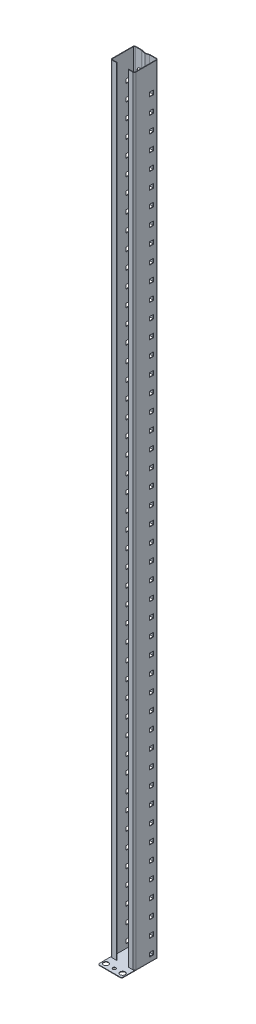
from build123d import *

# Parameters (mm, degrees)
BOSS_EXTRUDE1_DEPTH = 2438.4
SKETCH2_W           = 12.7
SKETCH2_H           = 12.7
CUT_EXTRUDE1_DEPTH  = 2440.826498226
CUT_EXTRUDE2_DEPTH  = 25.4
LPATTERN1_COUNT     = 47
LPATTERN1_PITCH     = 50.8
SKETCH4_R           = 4.7625
SKETCH4_R_2         = 7.9375
BOSS_EXTRUDE2_DEPTH = 1.5875


with BuildPart() as part:
    # Sketch1 → Boss-Extrude1 (new body)
    with BuildSketch(Plane(origin=(0, 0, 0), x_dir=(1, 0, 0), z_dir=(0, 1, 0))):
        with BuildLine():
            Line((-11.303227124, 37.1454439), (-1.227118373, 34.458481566))
            ThreePointArc((-1.227118373, 34.458481566), (0, 34.297675466), (1.227118373, 34.458481566))
            Line((1.227118373, 34.458481566), (11.303227124, 37.1454439))
            ThreePointArc((11.303227124, 37.1454439), (11.91154058, 37.265877352), (12.530345498, 37.30625))
            Line((12.530345498, 37.30625), (32.54375, 37.30625))
            ThreePointArc((32.54375, 37.30625), (35.911346045, 35.911346045), (37.30625, 32.54375))
            Line((37.30625, 32.54375), (37.30625, -32.54375))
            ThreePointArc((37.30625, -32.54375), (35.911346045, -35.911346045), (32.54375, -37.30625))
            Line((32.54375, -37.30625), (18.25625, -37.30625))
            Line((18.25625, -37.30625), (18.25625, -35.71875))
            Line((18.25625, -35.71875), (32.54375, -35.71875))
            ThreePointArc((32.54375, -35.71875), (34.78881403, -34.78881403), (35.71875, -32.54375))
            Line((35.71875, -32.54375), (35.71875, 32.54375))
            ThreePointArc((35.71875, 32.54375), (34.78881403, 34.78881403), (32.54375, 35.71875))
            Line((32.54375, 35.71875), (12.530345498, 35.71875))
            ThreePointArc((12.530345498, 35.71875), (12.117808886, 35.691834901), (11.712266582, 35.611545933))
            Line((11.712266582, 35.611545933), (1.636157831, 32.9245836))
            ThreePointArc((1.636157831, 32.9245836), (0, 32.710175466), (-1.636157831, 32.9245836))
            Line((-1.636157831, 32.9245836), (-11.712266582, 35.611545933))
            ThreePointArc((-11.712266582, 35.611545933), (-12.117808886, 35.691834901), (-12.530345498, 35.71875))
            Line((-12.530345498, 35.71875), (-32.54375, 35.71875))
            ThreePointArc((-32.54375, 35.71875), (-34.78881403, 34.78881403), (-35.71875, 32.54375))
            Line((-35.71875, 32.54375), (-35.71875, -32.54375))
            ThreePointArc((-35.71875, -32.54375), (-34.78881403, -34.78881403), (-32.54375, -35.71875))
            Line((-32.54375, -35.71875), (-18.25625, -35.71875))
            Line((-18.25625, -35.71875), (-18.25625, -37.30625))
            Line((-18.25625, -37.30625), (-32.54375, -37.30625))
            ThreePointArc((-32.54375, -37.30625), (-35.911346045, -35.911346045), (-37.30625, -32.54375))
            Line((-37.30625, -32.54375), (-37.30625, 32.54375))
            ThreePointArc((-37.30625, 32.54375), (-35.911346045, 35.911346045), (-32.54375, 37.30625))
            Line((-32.54375, 37.30625), (-12.530345498, 37.30625))
            ThreePointArc((-12.530345498, 37.30625), (-11.91154058, 37.265877352), (-11.303227124, 37.1454439))
        make_face()
    extrude(amount=BOSS_EXTRUDE1_DEPTH)

    # Sketch2 → Cut-Extrude1 (cut, through all)
    with BuildSketch(Plane(origin=(37.30625, 0, 0), x_dir=(0, 0, -1), z_dir=(1, 0, 0))):
        with Locations((16.66875, 19.05)):
            Rectangle(SKETCH2_W, SKETCH2_H)
    cut_extrude1 = extrude(amount=-CUT_EXTRUDE1_DEPTH, mode=Mode.SUBTRACT)

    # Sketch3 → Cut-Extrude2 (cut)
    with BuildSketch(Plane(origin=(0, 0, -37.30625), x_dir=(-1, 0, 0), z_dir=(0, 0, -1))):
        with BuildLine():
            Line((21.765456388, 28.121428571), (26.068412775, 37.192857143))
            ThreePointArc((26.068412775, 37.192857143), (14.628173804, 50.36852627), (12.7, 33.026108029))
            Line((12.7, 33.026108029), (12.7, 30.1625))
            ThreePointArc((12.7, 30.1625), (16.416417677, 25.516306071), (21.765456388, 28.121428571))
        make_face()
        with BuildLine():
            Line((-12.7, 30.1625), (-12.7, 33.026108029))
            ThreePointArc((-12.7, 33.026108029), (-14.628173804, 50.36852627), (-26.068412775, 37.192857143))
            Line((-26.068412775, 37.192857143), (-21.765456388, 28.121428571))
            ThreePointArc((-21.765456388, 28.121428571), (-16.416417677, 25.516306071), (-12.7, 30.1625))
        make_face()
    cut_extrude2 = extrude(amount=-CUT_EXTRUDE2_DEPTH, mode=Mode.SUBTRACT)

    # LPattern1: Cut-Extrude1, Cut-Extrude2 ×47
    with Locations(*[(0, i * LPATTERN1_PITCH, 0) for i in range(1, LPATTERN1_COUNT)]):
        add(cut_extrude1, mode=Mode.SUBTRACT)
        add(cut_extrude2, mode=Mode.SUBTRACT)


with BuildPart() as body_2:
    # Sketch4 → Boss-Extrude2 (new body)
    with BuildSketch(Plane.XZ):
        with BuildLine():
            Line((-32.54375, -37.30625), (32.54375, -37.30625))
            ThreePointArc((32.54375, -37.30625), (35.911346045, -35.911346045), (37.30625, -32.54375))
            Line((37.30625, -32.54375), (37.30625, 72.23125))
            ThreePointArc((37.30625, 72.23125), (35.911346045, 75.598846045), (32.54375, 76.99375))
            Line((32.54375, 76.99375), (-32.54375, 76.99375))
            ThreePointArc((-32.54375, 76.99375), (-35.911346045, 75.598846045), (-37.30625, 72.23125))
            Line((-37.30625, 72.23125), (-37.30625, -32.54375))
            ThreePointArc((-37.30625, -32.54375), (-35.911346045, -35.911346045), (-32.54375, -37.30625))
        make_face()
        with Locations((0, 62.70625)):
            Circle(SKETCH4_R, mode=Mode.SUBTRACT)
        with Locations((-26.19375, 62.70625)):
            Circle(SKETCH4_R_2, mode=Mode.SUBTRACT)
        with Locations((26.19375, 62.70625)):
            Circle(SKETCH4_R_2, mode=Mode.SUBTRACT)
        with Locations((0, -23.01875)):
            Circle(SKETCH4_R, mode=Mode.SUBTRACT)
        with Locations((26.19375, -23.01875)):
            Circle(SKETCH4_R_2, mode=Mode.SUBTRACT)
        with Locations((-26.19375, -23.01875)):
            Circle(SKETCH4_R_2, mode=Mode.SUBTRACT)
    extrude(amount=BOSS_EXTRUDE2_DEPTH)


solid = Compound([part.part, body_2.part])
